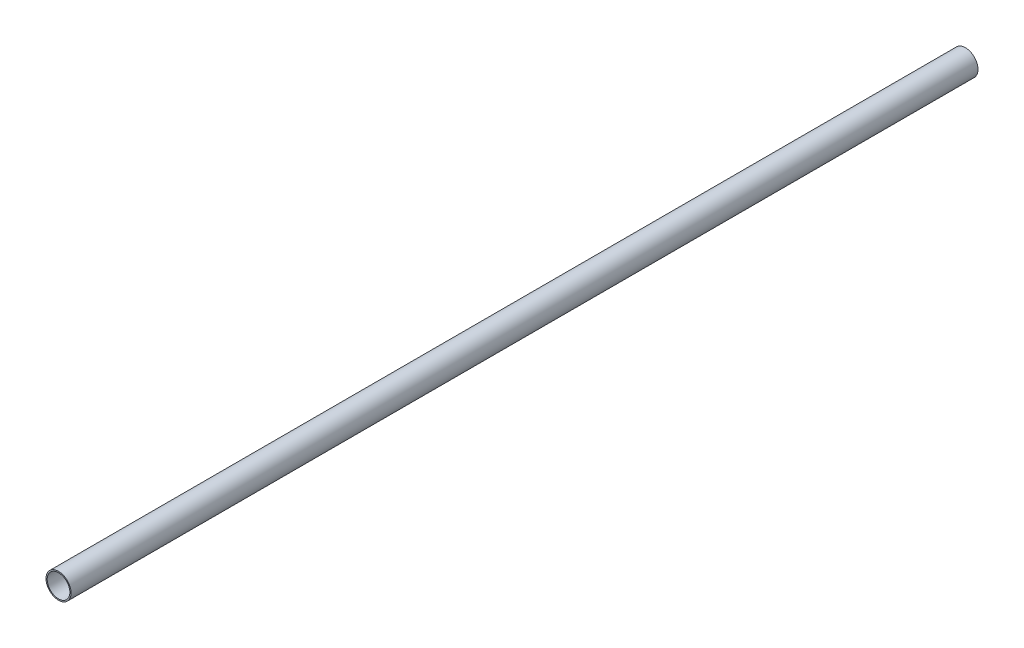
from build123d import *

# Parameters (mm, degrees)
SKETCH1_R           = 0.415
SKETCH1_R_2         = 0.375
BOSS_EXTRUDE1_DEPTH = 30


with BuildPart() as part:
    # Sketch1 → Boss-Extrude1 (new body)
    with BuildSketch(Plane.XY):
        Circle(SKETCH1_R)
        Circle(SKETCH1_R_2, mode=Mode.SUBTRACT)
    extrude(amount=BOSS_EXTRUDE1_DEPTH)


solid = part.part
